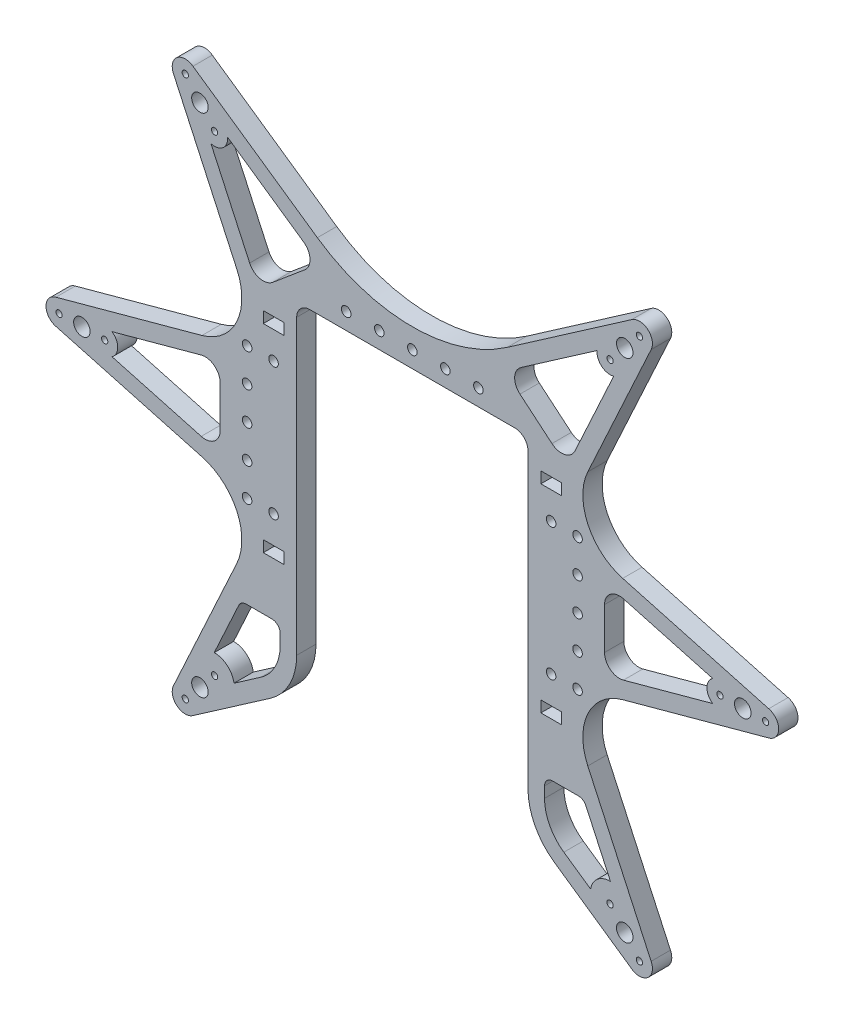
from build123d import *

# Parameters (mm, degrees)
SKETCH1_R           = 0.95
SKETCH1_R_2         = 2.5
SKETCH1_R_3         = 1.449999999
SKETCH1_R_4         = 1.45
SKETCH1_W           = 6.2
SKETCH1_H           = 3.4
BOSS_EXTRUDE1_DEPTH = 5.85
FILLET1_R           = 4


with BuildPart() as part:
    # Sketch1 → Boss-Extrude1 (new body)
    with BuildSketch(Plane.XY):
        with BuildLine():
            Line((576.616706289, 434.650231372), (532.426650002, 446.716128422))
            ThreePointArc((532.426650002, 446.716128422), (529.426650002, 450.550186325), (532.426650002, 454.384244227))
            Line((532.426650002, 454.384244227), (576.616706289, 466.450141278))
            ThreePointArc((576.616706289, 466.450141278), (587.144059076, 475.326320371), (587.176754813, 489.096238418))
            Line((587.176754813, 489.096238418), (568.014947547, 530.703594601))
            ThreePointArc((568.014947547, 530.703594601), (569.023643468, 535.466212845), (573.889065048, 535.63256443))
            Line((573.889065048, 535.63256443), (611.536899087, 509.536826494))
            ThreePointArc((611.536899087, 509.536826494), (640.276650002, 500.550186325), (669.016400917, 509.536826494))
            Line((669.016400917, 509.536826494), (706.664234956, 535.63256443))
            ThreePointArc((706.664234956, 535.63256443), (711.529656536, 535.466212845), (712.538352458, 530.703594601))
            Line((712.538352458, 530.703594601), (693.376545192, 489.096238418))
            ThreePointArc((693.376545192, 489.096238418), (693.409240928, 475.326320371), (703.936593716, 466.450141278))
            Line((703.936593716, 466.450141278), (748.126650002, 454.384244227))
            ThreePointArc((748.126650002, 454.384244227), (751.126650002, 450.550186325), (748.126650002, 446.716128422))
            Line((748.126650002, 446.716128422), (703.936593716, 434.650231372))
            ThreePointArc((703.936593716, 434.650231372), (693.409240928, 425.774052279), (693.376545192, 412.004134232))
            Line((693.376545192, 412.004134232), (712.538352458, 370.396778049))
            ThreePointArc((712.538352458, 370.396778049), (711.529656536, 365.634159805), (706.664234956, 365.46780822))
            Line((706.664234956, 365.46780822), (683.276650002, 381.679000803))
            ThreePointArc((683.276650002, 381.679000803), (677.397639803, 388.334757147), (675.276650002, 396.958170375))
            Line((675.276650002, 396.958170375), (675.276650002, 489.550186325))
            Line((675.276650002, 489.550186325), (605.276650002, 489.550186325))
            Line((605.276650002, 489.550186325), (605.276650002, 396.958170375))
            ThreePointArc((605.276650002, 396.958170375), (603.155660202, 388.334757147), (597.276650002, 381.679000803))
            Line((597.276650002, 381.679000803), (573.889065048, 365.46780822))
            ThreePointArc((573.889065048, 365.46780822), (569.023643468, 365.634159805), (568.014947547, 370.396778049))
            Line((568.014947547, 370.396778049), (587.176754813, 412.004134232))
            ThreePointArc((587.176754813, 412.004134232), (587.144059076, 425.774052279), (576.616706289, 434.650231372))
        make_face()
        with Locations((533.376650002, 450.550186325)):
            Circle(SKETCH1_R, mode=Mode.SUBTRACT)
        with Locations((575.997889034, 527.154630637)):
            Circle(SKETCH1_R_2, mode=Mode.SUBTRACT)
        with Locations((547.176650002, 450.550186325)):
            Circle(SKETCH1_R, mode=Mode.SUBTRACT)
        with Locations((540.276650002, 450.550186325)):
            Circle(SKETCH1_R_2, mode=Mode.SUBTRACT)
        with Locations((590.276650002, 460.550186325)):
            Circle(SKETCH1_R_3, mode=Mode.SUBTRACT)
        with Locations((571.562654527, 532.440337294)):
            Circle(SKETCH1_R, mode=Mode.SUBTRACT)
        with Locations((580.43312354, 521.868923979)):
            Circle(SKETCH1_R, mode=Mode.SUBTRACT)
        with Locations((682.276650002, 470.550186325)):
            Circle(SKETCH1_R_4, mode=Mode.SUBTRACT)
        with Locations((630.276650002, 494.550186325)):
            Circle(SKETCH1_R_4, mode=Mode.SUBTRACT)
        with Locations((620.276650002, 494.550186325)):
            Circle(SKETCH1_R_4, mode=Mode.SUBTRACT)
        with Locations((580.43312354, 379.231448671)):
            Circle(SKETCH1_R, mode=Mode.SUBTRACT)
        with Locations((575.997889034, 373.945742013)):
            Circle(SKETCH1_R_2, mode=Mode.SUBTRACT)
        with Locations((571.562654527, 368.660035356)):
            Circle(SKETCH1_R, mode=Mode.SUBTRACT)
        with Locations((590.276650002, 430.550186325)):
            Circle(SKETCH1_R_3, mode=Mode.SUBTRACT)
        with Locations((590.276650002, 440.550186325)):
            Circle(SKETCH1_R_3, mode=Mode.SUBTRACT)
        with Locations((590.276650002, 470.550186325)):
            Circle(SKETCH1_R_3, mode=Mode.SUBTRACT)
        with Locations((682.276650002, 430.550186325)):
            Circle(SKETCH1_R_4, mode=Mode.SUBTRACT)
        with Locations((708.990645478, 368.660035356)):
            Circle(SKETCH1_R, mode=Mode.SUBTRACT)
        with Locations((704.555410971, 373.945742013)):
            Circle(SKETCH1_R_2, mode=Mode.SUBTRACT)
        with Locations((700.120176464, 379.231448671)):
            Circle(SKETCH1_R, mode=Mode.SUBTRACT)
        with Locations((660.276650002, 494.550186325)):
            Circle(SKETCH1_R_4, mode=Mode.SUBTRACT)
        with Locations((650.276650002, 494.550186325)):
            Circle(SKETCH1_R_4, mode=Mode.SUBTRACT)
        with Locations((700.120176464, 521.868923979)):
            Circle(SKETCH1_R, mode=Mode.SUBTRACT)
        with Locations((708.990645478, 532.440337294)):
            Circle(SKETCH1_R, mode=Mode.SUBTRACT)
        with Locations((690.276650002, 450.550186325)):
            Circle(SKETCH1_R_3, mode=Mode.SUBTRACT)
        with Locations((740.276650002, 450.550186325)):
            Circle(SKETCH1_R_2, mode=Mode.SUBTRACT)
        with Locations((733.376650002, 450.550186325)):
            Circle(SKETCH1_R, mode=Mode.SUBTRACT)
        with Locations((704.555410971, 527.154630637)):
            Circle(SKETCH1_R_2, mode=Mode.SUBTRACT)
        with Locations((747.176650002, 450.550186325)):
            Circle(SKETCH1_R, mode=Mode.SUBTRACT)
        with Locations((690.276650002, 470.550186325)):
            Circle(SKETCH1_R_3, mode=Mode.SUBTRACT)
        with Locations((640.276650002, 494.550186325)):
            Circle(SKETCH1_R_4, mode=Mode.SUBTRACT)
        with Locations((690.276650002, 440.550186325)):
            Circle(SKETCH1_R_3, mode=Mode.SUBTRACT)
        with Locations((690.276650002, 430.550186325)):
            Circle(SKETCH1_R_3, mode=Mode.SUBTRACT)
        with Locations((690.276650002, 460.550186325)):
            Circle(SKETCH1_R_3, mode=Mode.SUBTRACT)
        with Locations((590.276650002, 450.550186325)):
            Circle(SKETCH1_R_3, mode=Mode.SUBTRACT)
        with Locations((598.276650002, 430.550186325)):
            Circle(SKETCH1_R_4, mode=Mode.SUBTRACT)
        with Locations((598.276650002, 470.550186325)):
            Circle(SKETCH1_R_4, mode=Mode.SUBTRACT)
        with BuildLine():
            Line((549.378217697, 453.82975942), (576.389421361, 461.205047663))
            ThreePointArc((576.389421361, 461.205047663), (580.337323048, 460.434368256), (582.12067631, 456.828882764))
            Line((582.12067631, 456.828882764), (582.12067631, 444.271489885))
            ThreePointArc((582.12067631, 444.271489885), (580.337323048, 440.666004394), (576.389421361, 439.895324987))
            Line((576.389421361, 439.895324987), (549.378217697, 447.27061323))
            ThreePointArc((549.378217697, 447.27061323), (551.126650002, 450.550186325), (549.378217697, 453.82975942))
        make_face(mode=Mode.SUBTRACT)
        with BuildLine():
            Line((590.015887334, 402.739634304), (597.776650002, 402.739634304))
            ThreePointArc((597.776650002, 402.739634304), (599.544416955, 402.007401257), (600.276650002, 400.239634304))
            Line((600.276650002, 400.239634304), (600.276650002, 396.958170375))
            ThreePointArc((600.276650002, 396.958170375), (598.726100476, 390.65402441), (594.428250258, 385.788333948))
            Line((594.428250258, 385.788333948), (586.310038369, 380.161164806))
            ThreePointArc((586.310038369, 380.161164806), (584.257709818, 383.789413107), (580.328199648, 385.180523471))
            Line((580.328199648, 385.180523471), (587.745126051, 401.285408274))
            ThreePointArc((587.745126051, 401.285408274), (588.667635675, 402.34491753), (590.015887334, 402.739634304))
        make_face(mode=Mode.SUBTRACT)
        with Locations((598.276650002, 420.515790438)):
            Rectangle(SKETCH1_W, SKETCH1_H, mode=Mode.SUBTRACT)
        with BuildLine():
            Line((694.243261635, 380.161164806), (686.125049746, 385.788333948))
            ThreePointArc((686.125049746, 385.788333948), (681.827199528, 390.65402441), (680.276650002, 396.958170375))
            Line((680.276650002, 396.958170375), (680.276650002, 400.239634304))
            ThreePointArc((680.276650002, 400.239634304), (681.008883049, 402.007401257), (682.776650002, 402.739634304))
            Line((682.776650002, 402.739634304), (690.53741267, 402.739634304))
            ThreePointArc((690.53741267, 402.739634304), (691.88566433, 402.34491753), (692.808173953, 401.285408274))
            Line((692.808173953, 401.285408274), (700.225100356, 385.180523471))
            ThreePointArc((700.225100356, 385.180523471), (696.295590186, 383.789413107), (694.243261635, 380.161164806))
        make_face(mode=Mode.SUBTRACT)
        with BuildLine():
            Line((579.335965232, 518.07435633), (591.048633694, 492.641829961))
            ThreePointArc((591.048633694, 492.641829961), (594.150648115, 490.133983107), (598.026414137, 491.077501553))
            Line((598.026414137, 491.077501553), (607.701712221, 499.196040607))
            ThreePointArc((607.701712221, 499.196040607), (609.303916208, 502.849084775), (607.372828334, 506.339455663))
            Line((607.372828334, 506.339455663), (584.360562722, 522.29049423))
            ThreePointArc((584.360562722, 522.29049423), (582.972134599, 518.843048429), (579.335965232, 518.07435633))
        make_face(mode=Mode.SUBTRACT)
        with Locations((682.276650002, 480.550186325)):
            Rectangle(SKETCH1_W, SKETCH1_H, mode=Mode.SUBTRACT)
        with BuildLine():
            Line((672.851587783, 499.196040607), (682.526885868, 491.077501553))
            ThreePointArc((682.526885868, 491.077501553), (686.402651889, 490.133983107), (689.50466631, 492.641829961))
            Line((689.50466631, 492.641829961), (701.217334773, 518.07435633))
            ThreePointArc((701.217334773, 518.07435633), (697.581165406, 518.843048429), (696.192737283, 522.29049423))
            Line((696.192737283, 522.29049423), (673.18047167, 506.339455663))
            ThreePointArc((673.18047167, 506.339455663), (671.249383797, 502.849084775), (672.851587783, 499.196040607))
        make_face(mode=Mode.SUBTRACT)
        with BuildLine():
            Line((698.432623695, 456.828882764), (698.432623695, 444.271489885))
            ThreePointArc((698.432623695, 444.271489885), (700.215976956, 440.666004394), (704.163878644, 439.895324987))
            Line((704.163878644, 439.895324987), (731.175082307, 447.27061323))
            ThreePointArc((731.175082307, 447.27061323), (729.426650002, 450.550186325), (731.175082307, 453.82975942))
            Line((731.175082307, 453.82975942), (704.163878644, 461.205047663))
            ThreePointArc((704.163878644, 461.205047663), (700.215976956, 460.434368256), (698.432623695, 456.828882764))
        make_face(mode=Mode.SUBTRACT)
        with Locations((682.276650002, 420.515790438)):
            Rectangle(SKETCH1_W, SKETCH1_H, mode=Mode.SUBTRACT)
        with Locations((598.276650002, 480.550186325)):
            Rectangle(SKETCH1_W, SKETCH1_H, mode=Mode.SUBTRACT)
    extrude(amount=BOSS_EXTRUDE1_DEPTH)

    # Fillet1
    fillet1_edges = [part.edges().sort_by_distance(p)[0] for p in [
        (675.276650002, 489.550186325, 2.925),
        (605.276650002, 489.550186325, 2.925),
    ]]
    fillet(fillet1_edges, radius=FILLET1_R)


solid = part.part
